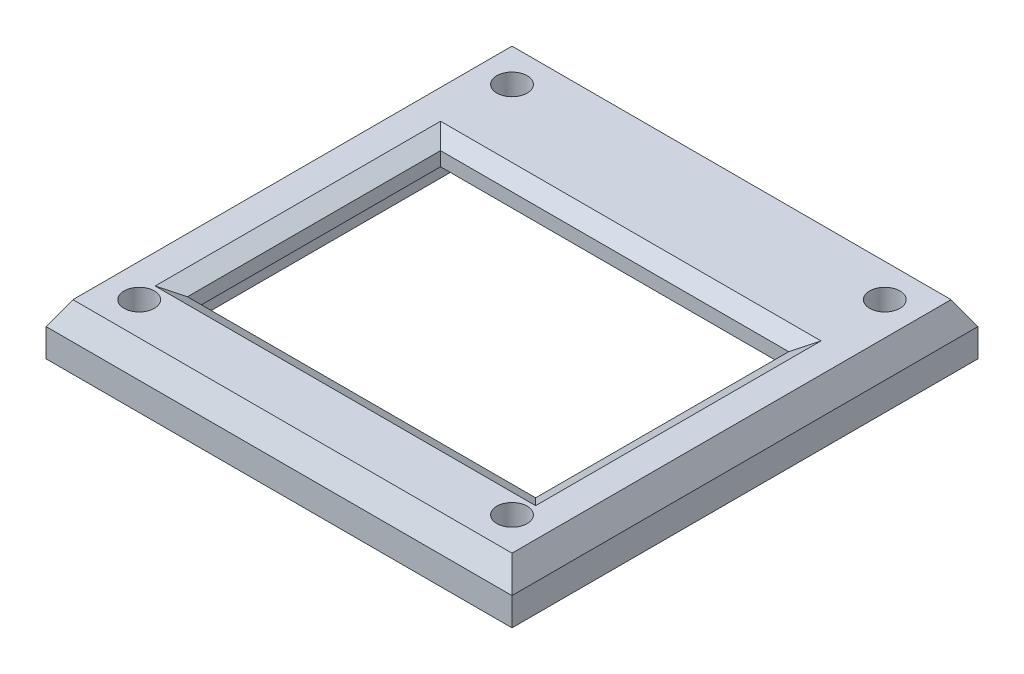
from build123d import *
from OCP.BRepFilletAPI import BRepFilletAPI_MakeChamfer

# Parameters (mm, degrees)
SKETCH1_W           = 50
SKETCH1_H           = 50
SKETCH1_W_2         = 46
SKETCH1_H_2         = 46
SKETCH1_R           = 1.625
SKETCH1_W_3         = 41.25
SKETCH1_H_3         = 34.25
BOSS_EXTRUDE1_DEPTH = 3
BOSS_EXTRUDE2_START = 3
SKETCH1_3_W         = 46
SKETCH1_3_H         = 46
SKETCH1_3_R         = 1.625
SKETCH1_3_W_2       = 41.25
SKETCH1_3_H_2       = 34.25
SKETCH1_3_W_3       = 37.362596296
SKETCH1_3_H_3       = 27.15767644
BOSS_EXTRUDE2_DEPTH = 2.5
CHAMFER1_SIZE       = 2
CHAMFER1_SIZE_2     = 3.464101615
CHAMFER2_SIZE       = 1
CHAMFER2_SIZE2      = 1.732050808


with BuildPart() as part:
    # Sketch1 → Boss-Extrude1 (new body)
    # profile 1 of 2: a face of its own
    with BuildSketch(Plane(origin=(0, 0, 0), x_dir=(1, 0, 0), z_dir=(0, 1, 0))):
        Rectangle(SKETCH1_W, SKETCH1_H)
        Rectangle(SKETCH1_W_2, SKETCH1_H_2, mode=Mode.SUBTRACT)
    # profile 2 of 2: a face of its own
    with BuildSketch(Plane(origin=(0, 0, 0), x_dir=(1, 0, 0), z_dir=(0, 1, 0))):
        Rectangle(SKETCH1_W_2, SKETCH1_H_2)
        with Locations(Location((-20, -20, 0), (0, 0, 270))):
            Circle(SKETCH1_R, mode=Mode.SUBTRACT)
        with Locations(Location((20, -20, 0), (0, 0, 270))):
            Circle(SKETCH1_R, mode=Mode.SUBTRACT)
        with Locations(Location((20, 20, 0), (0, 0, 270))):
            Circle(SKETCH1_R, mode=Mode.SUBTRACT)
        with Locations(Location((-20, 20, 0), (0, 0, 270))):
            Circle(SKETCH1_R, mode=Mode.SUBTRACT)
        with Locations((0, 0.35)):
            Rectangle(SKETCH1_W_3, SKETCH1_H_3, mode=Mode.SUBTRACT)
    extrude(amount=BOSS_EXTRUDE1_DEPTH)

    # Sketch1<3> → Boss-Extrude2 (add)
    # profile 1 of 2: a face of its own
    with BuildSketch(Plane(origin=(0, 0, 0), x_dir=(1, 0, 0), z_dir=(0, 1, 0)).offset(BOSS_EXTRUDE2_START)):
        Rectangle(SKETCH1_3_W, SKETCH1_3_H)
        with Locations(Location((-20, -20, 0), (0, 0, 270))):
            Circle(SKETCH1_3_R, mode=Mode.SUBTRACT)
        with Locations(Location((20, -20, 0), (0, 0, 270))):
            Circle(SKETCH1_3_R, mode=Mode.SUBTRACT)
        with Locations(Location((20, 20, 0), (0, 0, 270))):
            Circle(SKETCH1_3_R, mode=Mode.SUBTRACT)
        with Locations(Location((-20, 20, 0), (0, 0, 270))):
            Circle(SKETCH1_3_R, mode=Mode.SUBTRACT)
        with Locations((0, 0.35)):
            Rectangle(SKETCH1_3_W_2, SKETCH1_3_H_2, mode=Mode.SUBTRACT)
    # profile 2 of 2: a face of its own
    with BuildSketch(Plane(origin=(0, 0, 0), x_dir=(1, 0, 0), z_dir=(0, 1, 0)).offset(BOSS_EXTRUDE2_START)):
        with Locations((0, 0.35)):
            Rectangle(SKETCH1_3_W_2, SKETCH1_3_H_2)
        with Locations((0, -2.566787067)):
            Rectangle(SKETCH1_3_W_3, SKETCH1_3_H_3, mode=Mode.SUBTRACT)
    extrude(amount=BOSS_EXTRUDE2_DEPTH)

    # Chamfer1
    # the kernel refuses this chamfer: 3.464101615, 2 mm, written as the material it adds along each edge
    with BuildSketch(Plane(origin=(-23, 3, -23), x_dir=(0, -0.05789386240267147, -0.9983227437537926), z_dir=(1, 0, 0))) as chamfer1_piece_1_section:
        Polygon((CHAMFER1_SIZE * 0.998322743754, CHAMFER1_SIZE * 0.0578938624027), (-CHAMFER1_SIZE_2 * 0.057893862405, CHAMFER1_SIZE_2 * 0.998322743793), (0, 0), align=None)
    chamfer1_piece_1 = extrude(amount=46, mode=Mode.PRIVATE)
    chamfer1_piece_1 = split(chamfer1_piece_1, bisect_by=Plane(origin=(0, 3.976343679, -25), z_dir=(0, 0, 1)), keep=Keep.TOP, mode=Mode.PRIVATE)
    chamfer1_piece_1 = split(chamfer1_piece_1, bisect_by=Plane(origin=(0, 5.5, -23.695570033), z_dir=(0, -1, 0)), keep=Keep.TOP, mode=Mode.PRIVATE)
    add(chamfer1_piece_1)
    with BuildSketch(Plane(origin=(-23, 3, 23), x_dir=(-0.9983227437537926, -0.05789386240267147, 0), z_dir=(0, 0, -1))) as chamfer1_piece_2_section:
        Polygon((CHAMFER1_SIZE * 0.998322743754, CHAMFER1_SIZE * 0.0578938624027), (-CHAMFER1_SIZE_2 * 0.057893862405, CHAMFER1_SIZE_2 * 0.998322743793), (0, 0), align=None)
    chamfer1_piece_2 = extrude(amount=46, mode=Mode.PRIVATE)
    chamfer1_piece_2 = split(chamfer1_piece_2, bisect_by=Plane(origin=(-25, 3.976343679, 0), z_dir=(1, 0, 0)), keep=Keep.TOP, mode=Mode.PRIVATE)
    chamfer1_piece_2 = split(chamfer1_piece_2, bisect_by=Plane(origin=(-23.695570033, 5.5, 0), z_dir=(0, -1, 0)), keep=Keep.TOP, mode=Mode.PRIVATE)
    add(chamfer1_piece_2)
    with BuildSketch(Plane(origin=(23, 3, 23), x_dir=(0, -0.05789386240267147, 0.9983227437537926), z_dir=(-1, 0, 0))) as chamfer1_piece_3_section:
        Polygon((CHAMFER1_SIZE * 0.998322743754, CHAMFER1_SIZE * 0.0578938624027), (-CHAMFER1_SIZE_2 * 0.057893862405, CHAMFER1_SIZE_2 * 0.998322743793), (0, 0), align=None)
    chamfer1_piece_3 = extrude(amount=46, mode=Mode.PRIVATE)
    chamfer1_piece_3 = split(chamfer1_piece_3, bisect_by=Plane(origin=(0, 3.976343679, 25), z_dir=(0, 0, -1)), keep=Keep.TOP, mode=Mode.PRIVATE)
    chamfer1_piece_3 = split(chamfer1_piece_3, bisect_by=Plane(origin=(0, 5.5, 23.695570033), z_dir=(0, -1, 0)), keep=Keep.TOP, mode=Mode.PRIVATE)
    add(chamfer1_piece_3)
    with BuildSketch(Plane(origin=(23, 3, -23), x_dir=(0.9983227437537926, -0.05789386240267147, 0), z_dir=(0, 0, 1))) as chamfer1_piece_4_section:
        Polygon((CHAMFER1_SIZE * 0.998322743754, CHAMFER1_SIZE * 0.0578938624027), (-CHAMFER1_SIZE_2 * 0.057893862405, CHAMFER1_SIZE_2 * 0.998322743793), (0, 0), align=None)
    chamfer1_piece_4 = extrude(amount=46, mode=Mode.PRIVATE)
    chamfer1_piece_4 = split(chamfer1_piece_4, bisect_by=Plane(origin=(25, 3.976343679, 0), z_dir=(-1, 0, 0)), keep=Keep.TOP, mode=Mode.PRIVATE)
    chamfer1_piece_4 = split(chamfer1_piece_4, bisect_by=Plane(origin=(23.695570033, 5.5, 0), z_dir=(0, -1, 0)), keep=Keep.TOP, mode=Mode.PRIVATE)
    add(chamfer1_piece_4)
    with BuildSketch(Plane(origin=(-23, 3, 23), x_dir=(-0.9983227437537926, -0.05789386240267147, 0), z_dir=(0, 0, -1))) as chamfer1_piece_5a_section:
        Polygon((CHAMFER1_SIZE * 0.998322743754, CHAMFER1_SIZE * 0.0578938624027), (-CHAMFER1_SIZE_2 * 0.057893862405, CHAMFER1_SIZE_2 * 0.998322743793), (0, 0), align=None)
    chamfer1_piece_5a = extrude(amount=54.961927941, mode=Mode.PRIVATE)
    chamfer1_piece_5a = split(chamfer1_piece_5a, bisect_by=Plane(origin=(-23.695570033, 3.976343679, -25), z_dir=(0, 0, 1)), keep=Keep.TOP, mode=Mode.PRIVATE)
    chamfer1_piece_5a = split(chamfer1_piece_5a, bisect_by=Plane(origin=(-25, 3.976343679, -24), z_dir=(1, 0, 0)), keep=Keep.TOP, mode=Mode.PRIVATE)
    chamfer1_piece_5a = split(chamfer1_piece_5a, bisect_by=Plane(origin=(-23.695570033, 3.976343679, -23), z_dir=(0, 0, -1)), keep=Keep.TOP, mode=Mode.PRIVATE)
    chamfer1_piece_5a = split(chamfer1_piece_5a, bisect_by=Plane(origin=(-23.695570033, 5.5, -24), z_dir=(0, -1, 0)), keep=Keep.TOP, mode=Mode.PRIVATE)
    with BuildSketch(Plane(origin=(-31.961927941, 3, -23), x_dir=(0, -0.05789386240267147, -0.9983227437537926), z_dir=(1, 0, 0))) as chamfer1_piece_5b_section:
        Polygon((CHAMFER1_SIZE * 0.998322743754, CHAMFER1_SIZE * 0.0578938624027), (-CHAMFER1_SIZE_2 * 0.057893862405, CHAMFER1_SIZE_2 * 0.998322743793), (0, 0), align=None)
    chamfer1_piece_5b = extrude(amount=54.961927941, mode=Mode.PRIVATE)
    chamfer1_piece_5b = split(chamfer1_piece_5b, bisect_by=Plane(origin=(-24, 3.976343679, -25), z_dir=(0, 0, 1)), keep=Keep.TOP, mode=Mode.PRIVATE)
    chamfer1_piece_5b = split(chamfer1_piece_5b, bisect_by=Plane(origin=(-25, 3.976343679, -23.695570033), z_dir=(1, 0, 0)), keep=Keep.TOP, mode=Mode.PRIVATE)
    chamfer1_piece_5b = split(chamfer1_piece_5b, bisect_by=Plane(origin=(-23, 3.976343679, -23.695570033), z_dir=(-1, 0, 0)), keep=Keep.TOP, mode=Mode.PRIVATE)
    chamfer1_piece_5b = split(chamfer1_piece_5b, bisect_by=Plane(origin=(-24, 5.5, -23.695570033), z_dir=(0, -1, 0)), keep=Keep.TOP, mode=Mode.PRIVATE)
    chamfer1_piece_5 = chamfer1_piece_5a & chamfer1_piece_5b
    add(chamfer1_piece_5)
    with BuildSketch(Plane(origin=(23, 3, -31.961927941), x_dir=(0.9983227437537926, -0.05789386240267147, 0), z_dir=(0, 0, 1))) as chamfer1_piece_6a_section:
        Polygon((CHAMFER1_SIZE * 0.998322743754, CHAMFER1_SIZE * 0.0578938624027), (-CHAMFER1_SIZE_2 * 0.057893862405, CHAMFER1_SIZE_2 * 0.998322743793), (0, 0), align=None)
    chamfer1_piece_6a = extrude(amount=54.961927941, mode=Mode.PRIVATE)
    chamfer1_piece_6a = split(chamfer1_piece_6a, bisect_by=Plane(origin=(25, 3.976343679, -24), z_dir=(-1, 0, 0)), keep=Keep.TOP, mode=Mode.PRIVATE)
    chamfer1_piece_6a = split(chamfer1_piece_6a, bisect_by=Plane(origin=(23.695570033, 3.976343679, -25), z_dir=(0, 0, 1)), keep=Keep.TOP, mode=Mode.PRIVATE)
    chamfer1_piece_6a = split(chamfer1_piece_6a, bisect_by=Plane(origin=(23.695570033, 3.976343679, -23), z_dir=(0, 0, -1)), keep=Keep.TOP, mode=Mode.PRIVATE)
    chamfer1_piece_6a = split(chamfer1_piece_6a, bisect_by=Plane(origin=(23.695570033, 5.5, -24), z_dir=(0, -1, 0)), keep=Keep.TOP, mode=Mode.PRIVATE)
    with BuildSketch(Plane(origin=(-23, 3, -23), x_dir=(0, -0.05789386240267147, -0.9983227437537926), z_dir=(1, 0, 0))) as chamfer1_piece_6b_section:
        Polygon((CHAMFER1_SIZE * 0.998322743754, CHAMFER1_SIZE * 0.0578938624027), (-CHAMFER1_SIZE_2 * 0.057893862405, CHAMFER1_SIZE_2 * 0.998322743793), (0, 0), align=None)
    chamfer1_piece_6b = extrude(amount=54.961927941, mode=Mode.PRIVATE)
    chamfer1_piece_6b = split(chamfer1_piece_6b, bisect_by=Plane(origin=(25, 3.976343679, -23.695570033), z_dir=(-1, 0, 0)), keep=Keep.TOP, mode=Mode.PRIVATE)
    chamfer1_piece_6b = split(chamfer1_piece_6b, bisect_by=Plane(origin=(24, 3.976343679, -25), z_dir=(0, 0, 1)), keep=Keep.TOP, mode=Mode.PRIVATE)
    chamfer1_piece_6b = split(chamfer1_piece_6b, bisect_by=Plane(origin=(23, 3.976343679, -23.695570033), z_dir=(1, 0, 0)), keep=Keep.TOP, mode=Mode.PRIVATE)
    chamfer1_piece_6b = split(chamfer1_piece_6b, bisect_by=Plane(origin=(24, 5.5, -23.695570033), z_dir=(0, -1, 0)), keep=Keep.TOP, mode=Mode.PRIVATE)
    chamfer1_piece_6 = chamfer1_piece_6a & chamfer1_piece_6b
    add(chamfer1_piece_6)
    with BuildSketch(Plane(origin=(23, 3, 23), x_dir=(0, -0.05789386240267147, 0.9983227437537926), z_dir=(-1, 0, 0))) as chamfer1_piece_7a_section:
        Polygon((CHAMFER1_SIZE * 0.998322743754, CHAMFER1_SIZE * 0.0578938624027), (-CHAMFER1_SIZE_2 * 0.057893862405, CHAMFER1_SIZE_2 * 0.998322743793), (0, 0), align=None)
    chamfer1_piece_7a = extrude(amount=54.961927941, mode=Mode.PRIVATE)
    chamfer1_piece_7a = split(chamfer1_piece_7a, bisect_by=Plane(origin=(-24, 3.976343679, 25), z_dir=(0, 0, -1)), keep=Keep.TOP, mode=Mode.PRIVATE)
    chamfer1_piece_7a = split(chamfer1_piece_7a, bisect_by=Plane(origin=(-25, 3.976343679, 23.695570033), z_dir=(1, 0, 0)), keep=Keep.TOP, mode=Mode.PRIVATE)
    chamfer1_piece_7a = split(chamfer1_piece_7a, bisect_by=Plane(origin=(-24, 5.5, 23.695570033), z_dir=(0, -1, 0)), keep=Keep.TOP, mode=Mode.PRIVATE)
    chamfer1_piece_7a = split(chamfer1_piece_7a, bisect_by=Plane(origin=(-23, 3.976343679, 23.695570033), z_dir=(-1, 0, 0)), keep=Keep.TOP, mode=Mode.PRIVATE)
    with BuildSketch(Plane(origin=(-23, 3, 31.961927941), x_dir=(-0.9983227437537926, -0.05789386240267147, 0), z_dir=(0, 0, -1))) as chamfer1_piece_7b_section:
        Polygon((CHAMFER1_SIZE * 0.998322743754, CHAMFER1_SIZE * 0.0578938624027), (-CHAMFER1_SIZE_2 * 0.057893862405, CHAMFER1_SIZE_2 * 0.998322743793), (0, 0), align=None)
    chamfer1_piece_7b = extrude(amount=54.961927941, mode=Mode.PRIVATE)
    chamfer1_piece_7b = split(chamfer1_piece_7b, bisect_by=Plane(origin=(-23.695570033, 3.976343679, 25), z_dir=(0, 0, -1)), keep=Keep.TOP, mode=Mode.PRIVATE)
    chamfer1_piece_7b = split(chamfer1_piece_7b, bisect_by=Plane(origin=(-25, 3.976343679, 24), z_dir=(1, 0, 0)), keep=Keep.TOP, mode=Mode.PRIVATE)
    chamfer1_piece_7b = split(chamfer1_piece_7b, bisect_by=Plane(origin=(-23.695570033, 5.5, 24), z_dir=(0, -1, 0)), keep=Keep.TOP, mode=Mode.PRIVATE)
    chamfer1_piece_7b = split(chamfer1_piece_7b, bisect_by=Plane(origin=(-23.695570033, 3.976343679, 23), z_dir=(0, 0, 1)), keep=Keep.TOP, mode=Mode.PRIVATE)
    chamfer1_piece_7 = chamfer1_piece_7a & chamfer1_piece_7b
    add(chamfer1_piece_7)
    with BuildSketch(Plane(origin=(23, 3, -23), x_dir=(0.9983227437537926, -0.05789386240267147, 0), z_dir=(0, 0, 1))) as chamfer1_piece_8a_section:
        Polygon((CHAMFER1_SIZE * 0.998322743754, CHAMFER1_SIZE * 0.0578938624027), (-CHAMFER1_SIZE_2 * 0.057893862405, CHAMFER1_SIZE_2 * 0.998322743793), (0, 0), align=None)
    chamfer1_piece_8a = extrude(amount=54.961927941, mode=Mode.PRIVATE)
    chamfer1_piece_8a = split(chamfer1_piece_8a, bisect_by=Plane(origin=(25, 3.976343679, 24), z_dir=(-1, 0, 0)), keep=Keep.TOP, mode=Mode.PRIVATE)
    chamfer1_piece_8a = split(chamfer1_piece_8a, bisect_by=Plane(origin=(23.695570033, 3.976343679, 25), z_dir=(0, 0, -1)), keep=Keep.TOP, mode=Mode.PRIVATE)
    chamfer1_piece_8a = split(chamfer1_piece_8a, bisect_by=Plane(origin=(23.695570033, 5.5, 24), z_dir=(0, -1, 0)), keep=Keep.TOP, mode=Mode.PRIVATE)
    chamfer1_piece_8a = split(chamfer1_piece_8a, bisect_by=Plane(origin=(23.695570033, 3.976343679, 23), z_dir=(0, 0, 1)), keep=Keep.TOP, mode=Mode.PRIVATE)
    with BuildSketch(Plane(origin=(31.961927941, 3, 23), x_dir=(0, -0.05789386240267147, 0.9983227437537926), z_dir=(-1, 0, 0))) as chamfer1_piece_8b_section:
        Polygon((CHAMFER1_SIZE * 0.998322743754, CHAMFER1_SIZE * 0.0578938624027), (-CHAMFER1_SIZE_2 * 0.057893862405, CHAMFER1_SIZE_2 * 0.998322743793), (0, 0), align=None)
    chamfer1_piece_8b = extrude(amount=54.961927941, mode=Mode.PRIVATE)
    chamfer1_piece_8b = split(chamfer1_piece_8b, bisect_by=Plane(origin=(25, 3.976343679, 23.695570033), z_dir=(-1, 0, 0)), keep=Keep.TOP, mode=Mode.PRIVATE)
    chamfer1_piece_8b = split(chamfer1_piece_8b, bisect_by=Plane(origin=(24, 3.976343679, 25), z_dir=(0, 0, -1)), keep=Keep.TOP, mode=Mode.PRIVATE)
    chamfer1_piece_8b = split(chamfer1_piece_8b, bisect_by=Plane(origin=(24, 5.5, 23.695570033), z_dir=(0, -1, 0)), keep=Keep.TOP, mode=Mode.PRIVATE)
    chamfer1_piece_8b = split(chamfer1_piece_8b, bisect_by=Plane(origin=(23, 3.976343679, 23.695570033), z_dir=(1, 0, 0)), keep=Keep.TOP, mode=Mode.PRIVATE)
    chamfer1_piece_8 = chamfer1_piece_8a & chamfer1_piece_8b
    add(chamfer1_piece_8)

    # Chamfer2: one chamfer whose edges measure the first distance from different faces: ONE call of the kernel's chamfer builder (chamfer() names one face for all edges)
    chamfer2_edges_1 = [part.edges().sort_by_distance(p)[0] for p in [
        (-18.681298148, 5.5, 2.566787067),
    ]]
    chamfer2_side_1 = [part.faces().sort_by_distance(p)[0] for p in [
        (-18.681298148, 4.25, 2.566787067),
    ]]
    chamfer2_edges_2 = [part.edges().sort_by_distance(p)[0] for p in [
        (0, 5.5, -11.012051153),
    ]]
    chamfer2_side_2 = [part.faces().sort_by_distance(p)[0] for p in [
        (0, 4.25, -11.012051153),
    ]]
    chamfer2_edges_3 = [part.edges().sort_by_distance(p)[0] for p in [
        (18.681298148, 5.5, 2.566787067),
    ]]
    chamfer2_side_3 = [part.faces().sort_by_distance(p)[0] for p in [
        (18.681298148, 4.25, 2.566787067),
    ]]
    chamfer2_edges_4 = [part.edges().sort_by_distance(p)[0] for p in [
        (0, 5.5, 16.145625287),
    ]]
    chamfer2_side_4 = [part.faces().sort_by_distance(p)[0] for p in [
        (0, 4.25, 16.145625287),
    ]]
    chamfer2 = BRepFilletAPI_MakeChamfer(part.part.solid().wrapped)
    for e in chamfer2_edges_1:
        chamfer2.Add(CHAMFER2_SIZE, CHAMFER2_SIZE2, e.wrapped, chamfer2_side_1[0].wrapped)  # the first distance lies on this face
    for e in chamfer2_edges_2:
        chamfer2.Add(CHAMFER2_SIZE, CHAMFER2_SIZE2, e.wrapped, chamfer2_side_2[0].wrapped)  # the first distance lies on this face
    for e in chamfer2_edges_3:
        chamfer2.Add(CHAMFER2_SIZE, CHAMFER2_SIZE2, e.wrapped, chamfer2_side_3[0].wrapped)  # the first distance lies on this face
    for e in chamfer2_edges_4:
        chamfer2.Add(CHAMFER2_SIZE, CHAMFER2_SIZE2, e.wrapped, chamfer2_side_4[0].wrapped)  # the first distance lies on this face
    add(Compound.cast(chamfer2.Shape()), mode=Mode.REPLACE)


solid = part.part
